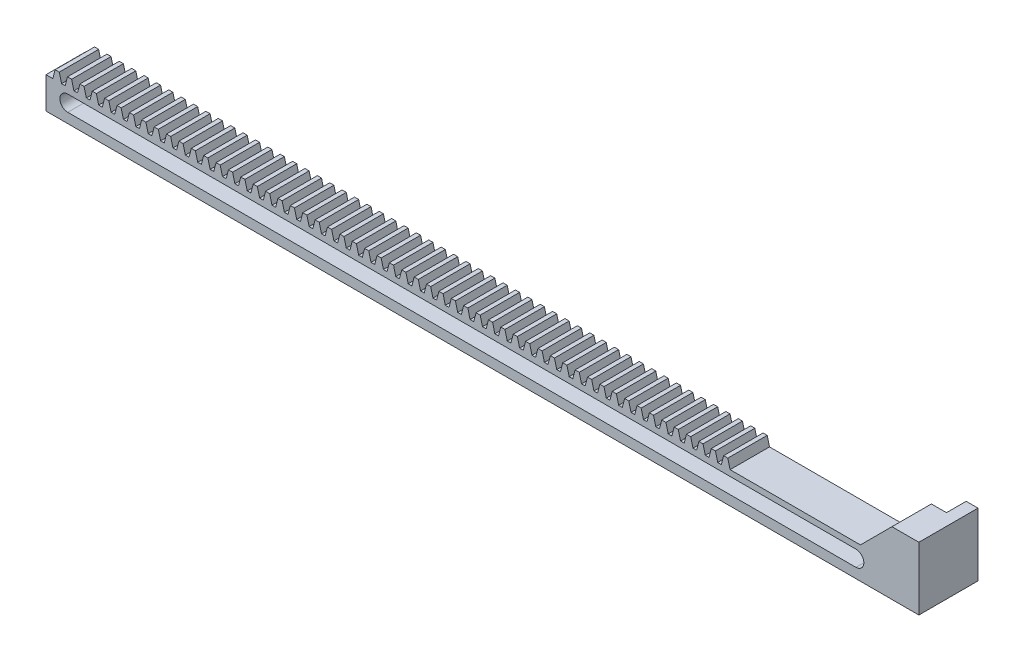
from build123d import *

# Parameters (mm, degrees)
SKETCH1_W           = 188.495559215
SKETCH1_H           = 8
EXTRUDE1_DEPTH      = 10
SKETCH_5_W          = 10
SKETCH_5_H          = 8
EXTRUDE_1_DEPTH     = 30
EXTRUDE2_DEPTH      = 10
LPATTERN1_COUNT     = 46
LPATTERN1_PITCH     = 3.141592654
LPATTERN1_COL_COUNT = 10
LPATTERN1_COL_PITCH = 3.1415
CUT_EXTRUDE_1_DEPTH = 6
CUT_EXTRUDE_2_DEPTH = 6
SKETCH_8_W          = 15
SKETCH_8_H          = 8
EXTRUDE_2_DEPTH     = 3
EXTRUDE_3_DEPTH     = 8
CHAMFER_1_SIZE      = 10


with BuildPart() as part:
    # Sketch1 → Extrude1 (new body)
    with BuildSketch(Plane.XY):
        with Locations((94.247779608, -4)):
            Rectangle(SKETCH1_W, SKETCH1_H)
    extrude(amount=EXTRUDE1_DEPTH)

    # 草图5 → 凸台-拉伸1 (add)
    with BuildSketch(Plane.ZY):
        with Locations((5, -4)):
            Rectangle(SKETCH_5_W, SKETCH_5_H)
    extrude(amount=EXTRUDE_1_DEPTH)

    # Sketch2 → Extrude2 (add)
    with BuildSketch(Plane.XY.offset(10)):
        Polygon((0, 0), (0.581889565, 2.25), (1.635450723, 2.25), (2.217340288, 0), align=None)
    extrude2 = extrude(amount=-EXTRUDE2_DEPTH)

    # LPattern1: Extrude2 ×46
    with Locations(*[(i * LPATTERN1_PITCH, 0, 0) for i in range(1, LPATTERN1_COUNT)]):
        add(extrude2)

    # LPattern1 col: Extrude2 ×10
    with Locations(*[(-i * LPATTERN1_COL_PITCH, 0, 0) for i in range(1, LPATTERN1_COL_COUNT)]):
        add(extrude2)

    # 草图2 → 切除-拉伸1 (cut)
    with BuildSketch(Plane.XY.offset(10)):
        with BuildLine():
            Line((-24.480798636, -1.5), (175.519201364, -1.5))
            ThreePointArc((175.519201364, -1.5), (177.519201364, -3.5), (175.519201364, -5.5))
            Line((175.519201364, -5.5), (-24.480798636, -5.5))
            ThreePointArc((-24.480798636, -5.5), (-26.480798636, -3.5), (-24.480798636, -1.5))
        make_face()
    extrude(amount=-CUT_EXTRUDE_1_DEPTH, mode=Mode.SUBTRACT)

    # 草图3 → 切除-拉伸2 (cut)
    with BuildSketch(Plane.XY.offset(4)):
        with BuildLine():
            Line((-24.480798636, -1.5), (175.519201364, -1.5))
            ThreePointArc((175.519201364, -1.5), (177.519201364, -3.5), (175.519201364, -5.5))
            Line((175.519201364, -5.5), (-24.480798636, -5.5))
            ThreePointArc((-24.480798636, -5.5), (-26.480798636, -3.5), (-24.480798636, -1.5))
        make_face()
    extrude(amount=-CUT_EXTRUDE_2_DEPTH, mode=Mode.SUBTRACT)

    # 草图8 → 凸台-拉伸2 (add)
    with BuildSketch(Plane(origin=(188.495559215, 0, 0), x_dir=(0, 0, -1), z_dir=(1, 0, 0))):
        with Locations((-2.5, -4)):
            Rectangle(SKETCH_8_W, SKETCH_8_H)
    extrude(amount=EXTRUDE_2_DEPTH)

    # 草图9 → 凸台-拉伸3 (add)
    with BuildSketch(Plane(origin=(0, 0, 0), x_dir=(1, 0, 0), z_dir=(0, 1, 0))):
        Polygon((188.495559215, 0), (186.659686987, 0), (186.659686987, -10), (191.495559215, -10), (191.495559215, 5), (188.495559215, 5), align=None)
    extrude(amount=EXTRUDE_3_DEPTH)

    # 倒角1
    # the kernel refuses this chamfer: 10 mm, written as the material it adds along each edge
    with BuildSketch(Plane(origin=(186.659686987, 0, 0), x_dir=(-0.9996219169112968, -0.027495876610586334, 0), z_dir=(0, 0, 1))) as chamfer_1_piece_1_section:
        Polygon((CHAMFER_1_SIZE * 0.999621916911, -CHAMFER_1_SIZE * 0.0274958766106), (-CHAMFER_1_SIZE * 0.0274958766106, -CHAMFER_1_SIZE * 0.999621916911), (0, 0), align=None)
    chamfer_1_piece_1 = extrude(amount=10, mode=Mode.PRIVATE)
    chamfer_1_piece_1 = split(chamfer_1_piece_1, bisect_by=Plane(origin=(183.202502863, 8, 5), z_dir=(0, -1, 0)), keep=Keep.TOP, mode=Mode.PRIVATE)
    add(chamfer_1_piece_1)


solid = part.part
